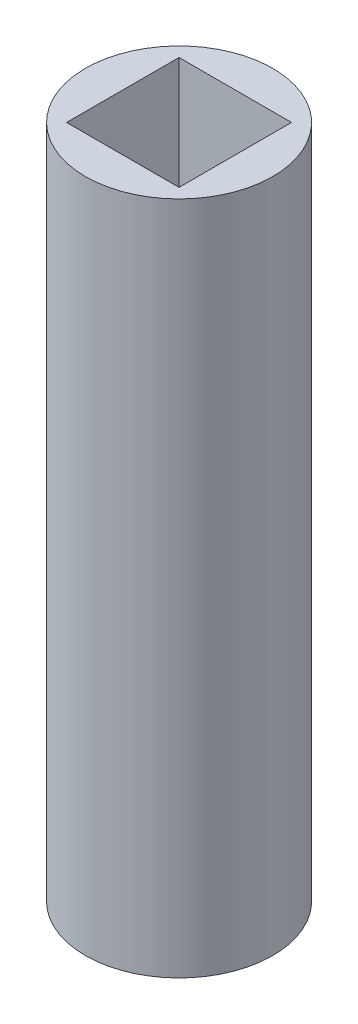
from build123d import *

# Parameters (mm, degrees)
SKETCH1_R           = 15.875
BOSS_EXTRUDE1_DEPTH = 114.3
SKETCH2_W           = 19.05
SKETCH2_H           = 19.05
CUT_EXTRUDE1_DEPTH  = 172.72


with BuildPart() as part:
    # Sketch1 → Boss-Extrude1 (new body)
    with BuildSketch(Plane(origin=(0, 0, 0), x_dir=(1, 0, 0), z_dir=(0, 1, 0))):
        Circle(SKETCH1_R)
    extrude(amount=BOSS_EXTRUDE1_DEPTH)

    # Sketch2 → Cut-Extrude1 (cut)
    with BuildSketch(Plane(origin=(0, 114.3, 0), x_dir=(1, 0, 0), z_dir=(0, 1, 0))):
        Rectangle(SKETCH2_W, SKETCH2_H)
    extrude(amount=-CUT_EXTRUDE1_DEPTH, mode=Mode.SUBTRACT)


solid = part.part
